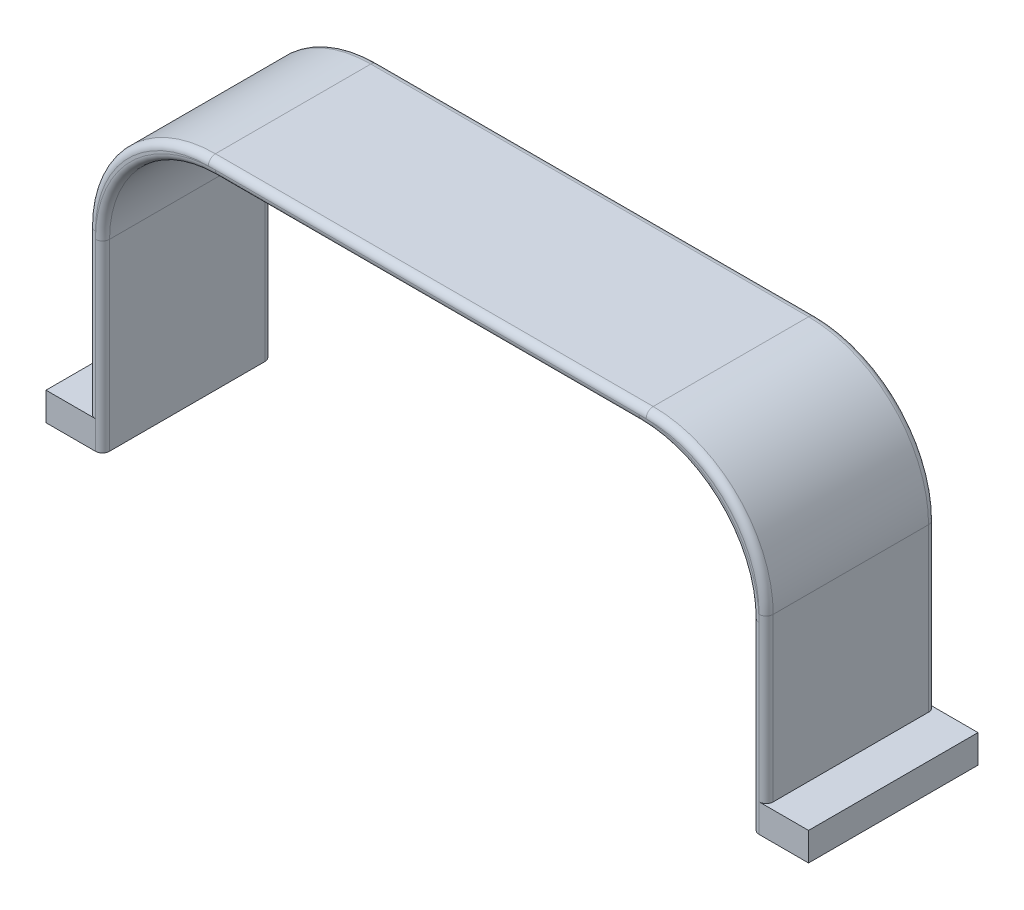
from build123d import *

# Parameters (mm, degrees)
BOSS_EXTRUDE1_DEPTH = 30
FILLET3_R           = 20
FILLET4_R           = 21.25
FILLET5_R           = 1.25


with BuildPart() as part:
    # Sketch1 → Boss-Extrude1 (new body)
    with BuildSketch(Plane.XY):
        Polygon((-67.5, 15), (-57.5, 15), (-57.5, 67.5), (57.5, 67.5), (57.5, 15), (67.5, 15), (67.5, 20), (60, 20), (60, 70), (-60, 70), (-60, 20), (-67.5, 20), align=None)
    extrude(amount=BOSS_EXTRUDE1_DEPTH)

    # Fillet3
    fillet3_edges = [part.edges().sort_by_distance(p)[0] for p in [
        (57.5, 67.5, 15),
        (-57.5, 67.5, 15),
    ]]
    fillet(fillet3_edges, radius=FILLET3_R)

    # Fillet4
    fillet4_edges = [part.edges().sort_by_distance(p)[0] for p in [
        (-60, 70, 15),
        (60, 70, 15),
    ]]
    fillet(fillet4_edges, radius=FILLET4_R)

    # Fillet5
    fillet5_edges = [part.edges().sort_by_distance(p)[0] for p in [
        (-57.5, 31.25, 0),
        (60, 34.375, 0),
        (60, 34.375, 30),
        (57.5, 31.25, 0),
        (57.5, 31.25, 30),
        (0, 67.5, 0),
        (0, 67.5, 30),
        (51.642135624, 61.642135624, 0),
        (51.642135624, 61.642135624, 30),
        (-51.642135624, 61.642135624, 0),
        (-51.642135624, 61.642135624, 30),
        (-57.5, 31.25, 30),
        (0, 70, 0),
        (0, 70, 30),
        (-60, 34.375, 0),
        (-53.7760191, 63.7760191, 0),
        (53.7760191, 63.7760191, 0),
        (-60, 34.375, 30),
        (-53.7760191, 63.7760191, 30),
        (53.7760191, 63.7760191, 30),
    ]]
    fillet(fillet5_edges, radius=FILLET5_R - 0.0001)  # a hair under: the kernel refuses the full size


solid = part.part
